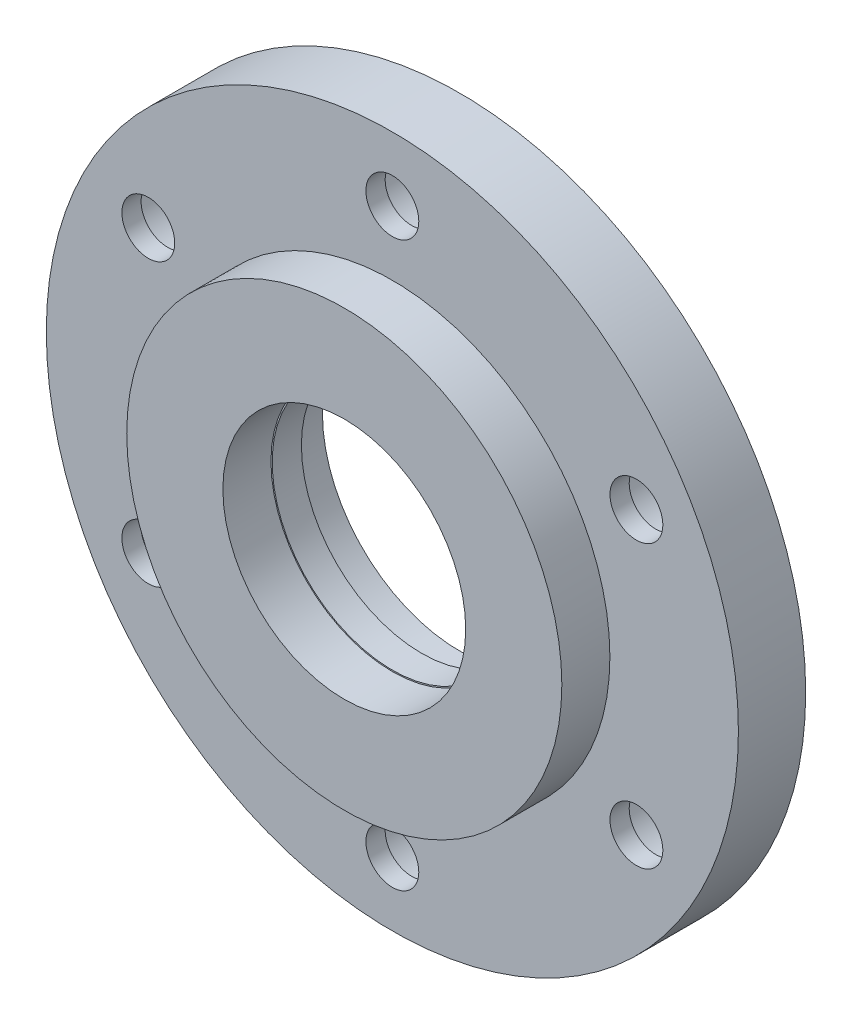
from build123d import *

# Parameters (mm, degrees)
SKETCH_CENTER_CUT_R            = 12.5
CUT_CENTER_DEPTH               = 52.39066063
CBORE_FOR_M5_SHCS2_D           = 5.5
CBORE_FOR_M5_SHCS2_CBORE_D     = 10
CBORE_FOR_M5_SHCS2_CBORE_DEPTH = 5
CIRPATTERN1_COUNT              = 6
SKETCH1_R                      = 14.2748
CUT_EXTRUDE1_DEPTH             = 3.9624


with BuildPart() as part:
    # Sketch Spindle Skeleton → Main Revolve (revolve)
    with BuildSketch(Plane(origin=(0, 0, 0), x_dir=(0, 0, -1), z_dir=(1, 0, 0))):
        Polygon((-21.7, 12.6312), (-21.7, 9.5), (-14.7, 9.5), (-14.7, 36), (-21.7, 36), (-21.7, 22.6312), (-26.7, 22.6312), (-26.7, 12.6312), align=None)
    revolve(axis=Axis((0, 0, 1000), (0, 0, -1)))

    # Sketch Center Cut → Cut Center (cut, through all)
    with BuildSketch(Plane.XY.offset(21.7)):
        Circle(SKETCH_CENTER_CUT_R)
    extrude(amount=-CUT_CENTER_DEPTH, mode=Mode.SUBTRACT)

    # CBORE for M5 SHCS2 (through all)
    with Locations(Plane(origin=(0, 0, 14.7), x_dir=(-1, 0, 0), z_dir=(0, 0, -1))):
        with Locations((0, 29.3156)):
            cbore_for_m5_shcs2 = CounterBoreHole(CBORE_FOR_M5_SHCS2_D / 2, CBORE_FOR_M5_SHCS2_CBORE_D / 2, CBORE_FOR_M5_SHCS2_CBORE_DEPTH)

    # CirPattern1: CBORE for M5 SHCS2 ×6 about axis
    cirpattern1_axis = Axis((0, 0, 14.7), (0, 0, 1))
    for i in range(1, CIRPATTERN1_COUNT):
        add(cbore_for_m5_shcs2.rotate(cirpattern1_axis, i * 360 / CIRPATTERN1_COUNT), mode=Mode.SUBTRACT)

    # Sketch1 → Cut-Extrude1 (cut)
    with BuildSketch(Plane(origin=(0, 0, 14.7), x_dir=(-1, 0, 0), z_dir=(0, 0, -1))):
        Circle(SKETCH1_R)
    extrude(amount=-CUT_EXTRUDE1_DEPTH, mode=Mode.SUBTRACT)


solid = part.part
